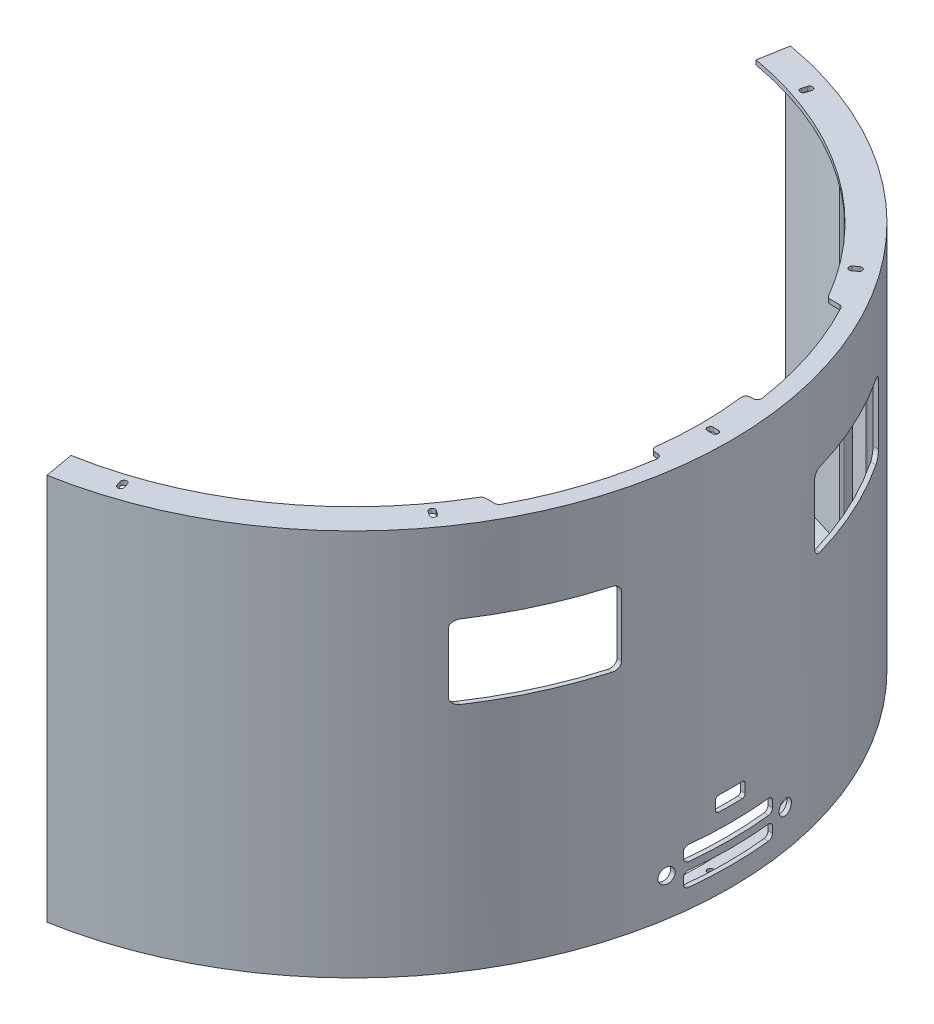
from build123d import *

# Parameters (mm, degrees)
BOSS_EXTRUDE1_DEPTH   = 255
BOSS_EXTRUDE2_DEPTH   = 255
BOSS_EXTRUDE2_2_DEPTH = 255
BOSS_EXTRUDE2_3_DEPTH = 255
BOSS_EXTRUDE2_4_DEPTH = 255
BOSS_EXTRUDE2_5_DEPTH = 255
BOSS_EXTRUDE2_6_DEPTH = 255
BOSS_EXTRUDE2_7_DEPTH = 255
BOSS_EXTRUDE2_8_DEPTH = 255
BOSS_EXTRUDE3_DEPTH   = 3
CUT_EXTRUDE3_DEPTH    = 5
LPATTERN1_COUNT       = 2
LPATTERN1_PITCH       = 258
LPATTERN2_COUNT       = 2
LPATTERN2_PITCH       = 258
CUT_EXTRUDE7_DEPTH    = 324
CUT_EXTRUDE10_DEPTH   = 5
FILLET2_R             = 3
CUT_EXTRUDE11_DEPTH   = 317
SKETCH15_R            = 5
CUT_EXTRUDE12_DEPTH   = 368


with BuildPart() as part:
    # Sketch3 → Boss-Extrude1 (new body)
    with BuildSketch(Plane(origin=(0, 0, 0), x_dir=(1, 0, 0), z_dir=(0, 1, 0))):
        with BuildLine():
            ThreePointArc((0, 251.5), (251.5, 0), (0, -251.5))
            ThreePointArc((0, -251.5), (-21.919669301, -250.54296657), (-43.672516683, -247.679149883))
            Line((-43.672516683, -247.679149883), (-44.193461216, -250.633573142))
            ThreePointArc((-44.193461216, -250.633573142), (-22.181136529, -253.531550664), (0, -254.5))
            ThreePointArc((0, -254.5), (254.5, 0), (0, 254.5))
            ThreePointArc((0, 254.5), (-22.181136529, 253.531550664), (-44.193461216, 250.633573142))
            Line((-44.193461216, 250.633573142), (-43.672516683, 247.679149883))
            ThreePointArc((-43.672516683, 247.679149883), (-21.919669301, 250.54296657), (0, 251.5))
        make_face()
    extrude(amount=BOSS_EXTRUDE1_DEPTH)


with BuildPart() as body_2:
    # Sketch6 → Boss-Extrude2 (new body)
    with BuildSketch(Plane(origin=(0, 255, 0), x_dir=(1, 0, 0), z_dir=(0, 1, 0))):
        with BuildLine():
            Line((-2, 253.081926056), (-2, 247.081926056))
            ThreePointArc((-2, 247.081926056), (-1.707106781, 246.374819275), (-1, 246.081926056))
            Line((-1, 246.081926056), (1, 246.081926056))
            ThreePointArc((1, 246.081926056), (1.707106781, 246.374819275), (2, 247.081926056))
            Line((2, 247.081926056), (2, 253.081926056))
            Line((2, 253.081926056), (-2, 253.081926056))
        make_face()
    extrude(amount=-BOSS_EXTRUDE2_DEPTH)


with BuildPart() as body_3:
    # Sketch6 → Boss-Extrude2 2 (new body)
    with BuildSketch(Plane(origin=(0, 255, 0), x_dir=(1, 0, 0), z_dir=(0, 1, 0))):
        with BuildLine():
            Line((108.006194645, 228.886703884), (105.40289221, 223.480890676))
            ThreePointArc((105.40289221, 223.480890676), (105.359977747, 222.716727875), (105.869977339, 222.146038069))
            Line((105.869977339, 222.146038069), (107.671915074, 221.278270591))
            ThreePointArc((107.671915074, 221.278270591), (108.436077876, 221.235356129), (109.006767681, 221.74535572))
            Line((109.006767681, 221.74535572), (111.610070116, 227.151168927))
            Line((111.610070116, 227.151168927), (108.006194645, 228.886703884))
        make_face()
    extrude(amount=-BOSS_EXTRUDE2_2_DEPTH)


with BuildPart() as body_4:
    # Sketch6 → Boss-Extrude2 3 (new body)
    with BuildSketch(Plane(origin=(0, 255, 0), x_dir=(1, 0, 0), z_dir=(0, 1, 0))):
        with BuildLine():
            Line((196.620437831, 159.357662896), (191.929448936, 155.616724085))
            ThreePointArc((191.929448936, 155.616724085), (191.559226528, 154.946857078), (191.771107255, 154.2114028))
            Line((191.771107255, 154.2114028), (193.018086859, 152.647739835))
            ThreePointArc((193.018086859, 152.647739835), (193.687953865, 152.277517427), (194.423408143, 152.489398155))
            Line((194.423408143, 152.489398155), (199.114397038, 156.230336966))
            Line((199.114397038, 156.230336966), (196.620437831, 159.357662896))
        make_face()
    extrude(amount=-BOSS_EXTRUDE2_3_DEPTH)


with BuildPart() as body_5:
    # Sketch6 → Boss-Extrude2 4 (new body)
    with BuildSketch(Plane(origin=(0, 255, 0), x_dir=(1, 0, 0), z_dir=(0, 1, 0))):
        with BuildLine():
            Line((246.291591913, 58.265882378), (240.44202444, 56.930756774))
            ThreePointArc((240.44202444, 56.930756774), (239.817821175, 56.487860938), (239.689617462, 55.733307928))
            Line((239.689617462, 55.733307928), (240.13465933, 53.783452104))
            ThreePointArc((240.13465933, 53.783452104), (240.577555165, 53.159248838), (241.332108176, 53.031045125))
            Line((241.332108176, 53.031045125), (247.181675649, 54.366170729))
            Line((247.181675649, 54.366170729), (246.291591913, 58.265882378))
        make_face()
    extrude(amount=-BOSS_EXTRUDE2_4_DEPTH)


with BuildPart() as body_6:
    # Sketch6 → Boss-Extrude2 5 (new body)
    with BuildSketch(Plane(origin=(0, 255, 0), x_dir=(1, 0, 0), z_dir=(0, 1, 0))):
        with BuildLine():
            Line((247.181675649, -54.366170729), (241.332108176, -53.031045125))
            ThreePointArc((241.332108176, -53.031045125), (240.577555165, -53.159248838), (240.13465933, -53.783452104))
            Line((240.13465933, -53.783452104), (239.689617462, -55.733307928))
            ThreePointArc((239.689617462, -55.733307928), (239.817821175, -56.487860938), (240.44202444, -56.930756774))
            Line((240.44202444, -56.930756774), (246.291591913, -58.265882378))
            Line((246.291591913, -58.265882378), (247.181675649, -54.366170729))
        make_face()
    extrude(amount=-BOSS_EXTRUDE2_5_DEPTH)


with BuildPart() as body_7:
    # Sketch6 → Boss-Extrude2 6 (new body)
    with BuildSketch(Plane(origin=(0, 255, 0), x_dir=(1, 0, 0), z_dir=(0, 1, 0))):
        with BuildLine():
            Line((199.114397038, -156.230336966), (194.423408143, -152.489398155))
            ThreePointArc((194.423408143, -152.489398155), (193.687953865, -152.277517427), (193.018086859, -152.647739835))
            Line((193.018086859, -152.647739835), (191.771107255, -154.2114028))
            ThreePointArc((191.771107255, -154.2114028), (191.559226528, -154.946857078), (191.929448936, -155.616724085))
            Line((191.929448936, -155.616724085), (196.620437831, -159.357662896))
            Line((196.620437831, -159.357662896), (199.114397038, -156.230336966))
        make_face()
    extrude(amount=-BOSS_EXTRUDE2_6_DEPTH)


with BuildPart() as body_8:
    # Sketch6 → Boss-Extrude2 7 (new body)
    with BuildSketch(Plane(origin=(0, 255, 0), x_dir=(1, 0, 0), z_dir=(0, 1, 0))):
        with BuildLine():
            Line((111.610070116, -227.151168927), (109.006767681, -221.74535572))
            ThreePointArc((109.006767681, -221.74535572), (108.436077876, -221.235356129), (107.671915074, -221.278270591))
            Line((107.671915074, -221.278270591), (105.869977339, -222.146038069))
            ThreePointArc((105.869977339, -222.146038069), (105.359977747, -222.716727875), (105.40289221, -223.480890676))
            Line((105.40289221, -223.480890676), (108.006194645, -228.886703884))
            Line((108.006194645, -228.886703884), (111.610070116, -227.151168927))
        make_face()
    extrude(amount=-BOSS_EXTRUDE2_7_DEPTH)


with BuildPart() as body_9:
    # Sketch6 → Boss-Extrude2 8 (new body)
    with BuildSketch(Plane(origin=(0, 255, 0), x_dir=(1, 0, 0), z_dir=(0, 1, 0))):
        with BuildLine():
            Line((2, -253.081926056), (2, -247.081926056))
            ThreePointArc((2, -247.081926056), (1.707106781, -246.374819275), (1, -246.081926056))
            Line((1, -246.081926056), (-1, -246.081926056))
            ThreePointArc((-1, -246.081926056), (-1.707106781, -246.374819275), (-2, -247.081926056))
            Line((-2, -247.081926056), (-2, -253.081926056))
            Line((-2, -253.081926056), (2, -253.081926056))
        make_face()
    extrude(amount=-BOSS_EXTRUDE2_8_DEPTH)


with BuildPart() as body_2_1:
    add(body_2.part)

    # Combine2: union part, body 3, body 4, body 5, body 6, body 7, body 8, body 9
    add(part.part)
    add(body_3.part)
    add(body_4.part)
    add(body_5.part)
    add(body_6.part)
    add(body_7.part)
    add(body_8.part)
    add(body_9.part)

    # Sketch7 → Boss-Extrude3 (add)
    with BuildSketch(Plane(origin=(0, 255, 0), x_dir=(1, 0, 0), z_dir=(0, 1, 0))):
        with BuildLine():
            ThreePointArc((-44.193461216, -250.633573142), (254.5, 0), (-44.193461216, 250.633573142))
            Line((-44.193461216, 250.633573142), (-40.720497663, 230.937418081))
            ThreePointArc((-40.720497663, 230.937418081), (234.5, 0), (-40.720497663, -230.937418081))
            Line((-40.720497663, -230.937418081), (-44.193461216, -250.633573142))
        make_face()
    boss_extrude3 = extrude(amount=BOSS_EXTRUDE3_DEPTH)

    # Sketch8 → Cut-Extrude3 (cut)
    with BuildSketch(Plane.XZ.offset(-255)):
        with BuildLine():
            Line((240.8, 2), (244.2, 2))
            ThreePointArc((244.2, 2), (246.2, 0), (244.2, -2))
            Line((244.2, -2), (240.8, -2))
            ThreePointArc((240.8, -2), (238.8, 0), (240.8, 2))
        make_face()
        with BuildLine():
            Line((195.98686275, -139.920654763), (198.737520531, -141.919124621))
            ThreePointArc((198.737520531, -141.919124621), (199.179984015, -144.712729114), (196.386379522, -145.155192599))
            Line((196.386379522, -145.155192599), (193.635721741, -143.156722741))
            ThreePointArc((193.635721741, -143.156722741), (193.193258257, -140.363118247), (195.98686275, -139.920654763))
        make_face()
        with BuildLine():
            Line((76.313405278, -228.396375135), (77.364063059, -231.629967291))
            ThreePointArc((77.364063059, -231.629967291), (76.079984015, -234.150114312), (73.559836994, -232.866035268))
            Line((73.559836994, -232.866035268), (72.509179213, -229.632443113))
            ThreePointArc((72.509179213, -229.632443113), (73.793258257, -227.112296091), (76.313405278, -228.396375135))
        make_face()
        with BuildLine():
            Line((-72.509179213, -229.632443113), (-73.559836994, -232.866035268))
            ThreePointArc((-73.559836994, -232.866035268), (-76.079984015, -234.150114312), (-77.364063059, -231.629967291))
            Line((-77.364063059, -231.629967291), (-76.313405278, -228.396375135))
            ThreePointArc((-76.313405278, -228.396375135), (-73.793258257, -227.112296091), (-72.509179213, -229.632443113))
        make_face()
        with BuildLine():
            Line((-193.635721741, -143.156722741), (-196.386379522, -145.155192599))
            ThreePointArc((-196.386379522, -145.155192599), (-199.179984015, -144.712729114), (-198.737520531, -141.919124621))
            Line((-198.737520531, -141.919124621), (-195.98686275, -139.920654763))
            ThreePointArc((-195.98686275, -139.920654763), (-193.193258257, -140.363118247), (-193.635721741, -143.156722741))
        make_face()
        with BuildLine():
            Line((-240.8, -2), (-244.2, -2))
            ThreePointArc((-244.2, -2), (-246.2, 0), (-244.2, 2))
            Line((-244.2, 2), (-240.8, 2))
            ThreePointArc((-240.8, 2), (-238.8, 0), (-240.8, -2))
        make_face()
        with BuildLine():
            Line((-195.98686275, 139.920654763), (-198.737520531, 141.919124621))
            ThreePointArc((-198.737520531, 141.919124621), (-199.179984015, 144.712729114), (-196.386379522, 145.155192599))
            Line((-196.386379522, 145.155192599), (-193.635721741, 143.156722741))
            ThreePointArc((-193.635721741, 143.156722741), (-193.193258257, 140.363118247), (-195.98686275, 139.920654763))
        make_face()
        with BuildLine():
            Line((-76.313405278, 228.396375135), (-77.364063059, 231.629967291))
            ThreePointArc((-77.364063059, 231.629967291), (-76.079984015, 234.150114312), (-73.559836994, 232.866035268))
            Line((-73.559836994, 232.866035268), (-72.509179213, 229.632443113))
            ThreePointArc((-72.509179213, 229.632443113), (-73.793258257, 227.112296091), (-76.313405278, 228.396375135))
        make_face()
        with BuildLine():
            Line((72.509179213, 229.632443113), (73.559836994, 232.866035268))
            ThreePointArc((73.559836994, 232.866035268), (76.079984015, 234.150114312), (77.364063059, 231.629967291))
            Line((77.364063059, 231.629967291), (76.313405278, 228.396375135))
            ThreePointArc((76.313405278, 228.396375135), (73.793258257, 227.112296091), (72.509179213, 229.632443113))
        make_face()
        with BuildLine():
            Line((193.635721741, 143.156722741), (196.386379522, 145.155192599))
            ThreePointArc((196.386379522, 145.155192599), (199.179984015, 144.712729114), (198.737520531, 141.919124621))
            Line((198.737520531, 141.919124621), (195.98686275, 139.920654763))
            ThreePointArc((195.98686275, 139.920654763), (193.193258257, 140.363118247), (193.635721741, 143.156722741))
        make_face()
    cut_extrude3 = extrude(amount=-CUT_EXTRUDE3_DEPTH, mode=Mode.SUBTRACT)

    # LPattern1: Boss-Extrude3 ×2
    with Locations(*[(0, -i * LPATTERN1_PITCH, 0) for i in range(1, LPATTERN1_COUNT)]):
        add(boss_extrude3)

    # LPattern2: Cut-Extrude3 ×2
    with Locations(*[(0, -i * LPATTERN2_PITCH, 0) for i in range(1, LPATTERN2_COUNT)]):
        add(cut_extrude3, mode=Mode.SUBTRACT)

    # Sketch11 → Cut-Extrude7 (cut)
    with BuildSketch(Plane(origin=(0, 258, 0), x_dir=(1, 0, 0), z_dir=(0, 1, 0))):
        with BuildLine():
            Line((-44.193461216, 250.633573142), (0, 0))
            Line((0, 0), (44.193461216, 250.633573142))
            ThreePointArc((44.193461216, 250.633573142), (0, 254.5), (-44.193461216, 250.633573142))
        make_face()
    cut_extrude7 = extrude(amount=-CUT_EXTRUDE7_DEPTH, mode=Mode.SUBTRACT)

    # Mirror1: Cut-Extrude7 across plane
    add(cut_extrude7.mirror(Plane.XY), mode=Mode.SUBTRACT)

    # Sketch13 → Cut-Extrude10 (cut)
    with BuildSketch(Plane(origin=(0, 258, 0), x_dir=(1, 0, 0), z_dir=(0, 1, 0))):
        with BuildLine():
            Line((240.8, 32.135476301), (189.842924972, 32.135476301))
            Line((189.842924972, 32.135476301), (189.842924972, 116.171040312))
            Line((189.842924972, 116.171040312), (213.357957972, 116.171040312))
            ThreePointArc((213.357957972, 116.171040312), (230.93366299, 75.412015854), (240.8, 32.135476301))
        make_face()
        with BuildLine():
            Line((189.842924972, -116.171040312), (213.357957972, -116.171040312))
            ThreePointArc((213.357957972, -116.171040312), (230.93366299, -75.412015854), (240.8, -32.135476301))
            Line((240.8, -32.135476301), (189.842924972, -32.135476301))
            Line((189.842924972, -32.135476301), (189.842924972, -116.171040312))
        make_face()
    extrude(amount=-CUT_EXTRUDE10_DEPTH, mode=Mode.SUBTRACT)

    # Fillet2
    fillet2_edges = [body_2_1.edges().sort_by_distance(p)[0] for p in [
        (203.702084901, 256.5, 116.171040312),
        (213.357957972, 256.5, 116.171040312),
        (232.287668986, 256.5, 32.135476301),
        (240.8, 256.5, 32.135476301),
        (232.287668986, 256.5, -32.135476301),
        (240.8, 256.5, -32.135476301),
        (213.357957972, 256.5, -116.171040312),
        (203.702084901, 256.5, -116.171040312),
    ]]
    fillet(fillet2_edges, radius=FILLET2_R)

    # Sketch14 → Cut-Extrude11 (cut)
    with BuildSketch(Plane(origin=(0, 0, 0), x_dir=(0, 0, -1), z_dir=(1, 0, 0))):
        with BuildLine():
            Line((-140, 153), (-70, 153))
            ThreePointArc((-70, 153), (-66.464466094, 154.464466094), (-65, 158))
            Line((-65, 158), (-65, 198))
            ThreePointArc((-65, 198), (-66.464466094, 201.535533906), (-70, 203))
            Line((-70, 203), (-140, 203))
            ThreePointArc((-140, 203), (-143.535533906, 201.535533906), (-145, 198))
            Line((-145, 198), (-145, 158))
            ThreePointArc((-145, 158), (-143.535533906, 154.464466094), (-140, 153))
        make_face()
    cut_extrude11 = extrude(amount=CUT_EXTRUDE11_DEPTH, mode=Mode.SUBTRACT)

    # Mirror2: Cut-Extrude11 across plane
    add(cut_extrude11.mirror(Plane.XY), mode=Mode.SUBTRACT)

    # Sketch15 → Cut-Extrude12 (cut)
    with BuildSketch(Plane(origin=(0, 0, 0), x_dir=(0, 0, -1), z_dir=(1, 0, 0))):
        with Locations((40, 22.5)):
            Circle(SKETCH15_R)
        with Locations((-40, 22.5)):
            Circle(SKETCH15_R)
        with BuildLine():
            Line((-27, 10), (27, 10))
            ThreePointArc((27, 10), (29.121320344, 10.878679656), (30, 13))
            Line((30, 13), (30, 17))
            ThreePointArc((30, 17), (29.121320344, 19.121320344), (27, 20))
            Line((27, 20), (-27, 20))
            ThreePointArc((-27, 20), (-29.121320344, 19.121320344), (-30, 17))
            Line((-30, 17), (-30, 13))
            ThreePointArc((-30, 13), (-29.121320344, 10.878679656), (-27, 10))
        make_face()
        with BuildLine():
            Line((-27, 25), (27, 25))
            ThreePointArc((27, 25), (29.121320344, 25.878679656), (30, 28))
            Line((30, 28), (30, 32))
            ThreePointArc((30, 32), (29.121320344, 34.121320344), (27, 35))
            Line((27, 35), (-27, 35))
            ThreePointArc((-27, 35), (-29.121320344, 34.121320344), (-30, 32))
            Line((-30, 32), (-30, 28))
            ThreePointArc((-30, 28), (-29.121320344, 25.878679656), (-27, 25))
        make_face()
        with BuildLine():
            Line((-8, 45), (8, 45))
            ThreePointArc((8, 45), (9.414213562, 45.585786438), (10, 47))
            Line((10, 47), (10, 53))
            ThreePointArc((10, 53), (9.414213562, 54.414213562), (8, 55))
            Line((8, 55), (-8, 55))
            ThreePointArc((-8, 55), (-9.414213562, 54.414213562), (-10, 53))
            Line((-10, 53), (-10, 47))
            ThreePointArc((-10, 47), (-9.414213562, 45.585786438), (-8, 45))
        make_face()
    extrude(amount=CUT_EXTRUDE12_DEPTH, mode=Mode.SUBTRACT)


solid = body_2_1.part
